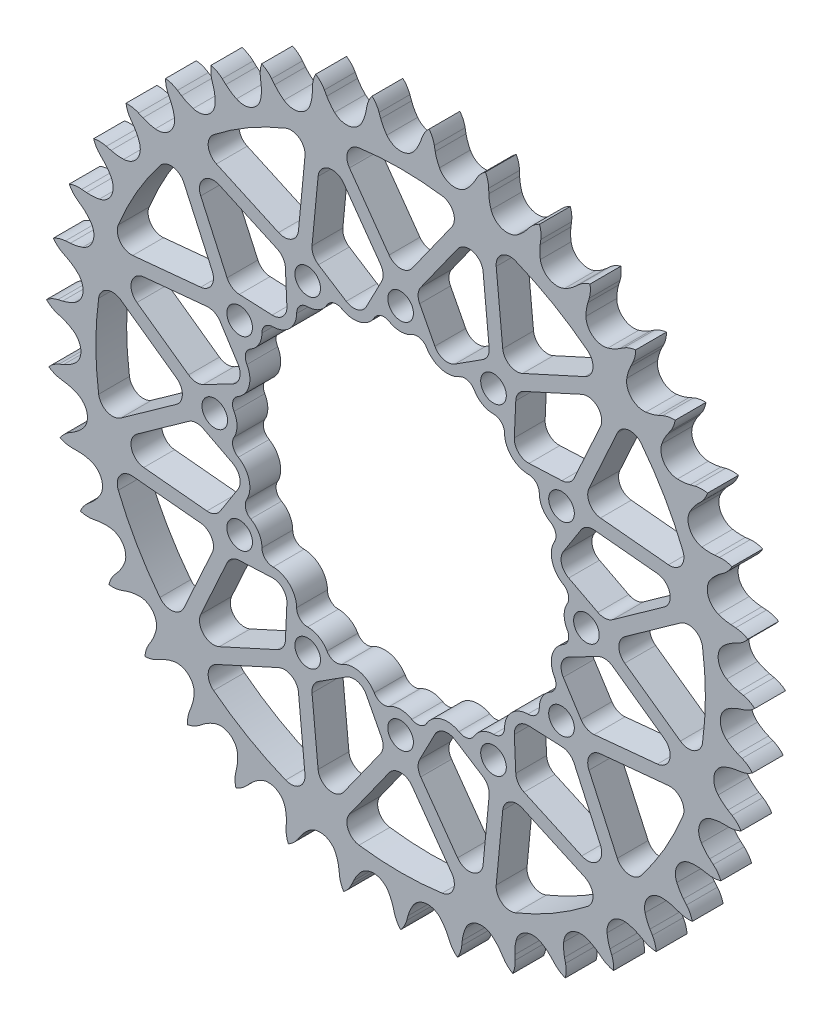
from build123d import *

# Parameters (mm, degrees)
EXTRUSION_DEPTH          = 7.2136
CUT_EXTRUDE_DEPTH        = 118.514389318
CUT_EXTRUDE_DEPTH_BACK   = 118.514389318
SKETCH1_R                = 35.764294032
F_6_0MM_DOWEL_HOLE1_D    = 6
CIRPATTERN1_COUNT        = 12
CUT_EXTRUDE2_DEPTH       = 118.514389318
FILLET2_R                = 3.302
CIRPATTERN3_COUNT        = 12
FILLET2_OF_CIRPATTERN3_R = 3.302
SKETCH14_R               = 35.764294032
CUT_EXTRUDE7_DEPTH       = 118.514389318


with BuildPart() as part:
    # Teeth Sketch → Extrusion (new body)
    with BuildSketch(Plane.XY):
        with BuildLine():
            ThreePointArc((6.676484762, 82.703103732), (5.710873677, 81.555589606), (5.037571935, 80.215493266))
            Line((5.037571935, 80.215493266), (4.65053543, 79.150636707))
            ThreePointArc((4.65053543, 79.150636707), (4.030589042, 77.787636082), (3.22092759, 76.5280518))
            ThreePointArc((3.22092759, 76.5280518), (0, 74.905926143), (-3.22092759, 76.5280518))
            ThreePointArc((-3.22092759, 76.5280518), (-4.030589042, 77.787636082), (-4.65053543, 79.150636707))
            Line((-4.65053543, 79.150636707), (-5.037571935, 80.215493266))
            ThreePointArc((-5.037571935, 80.215493266), (-5.710873677, 81.555589606), (-6.676484762, 82.703103732))
            ThreePointArc((-6.676484762, 82.703103732), (-7.445517227, 81.415554702), (-7.895133318, 79.984807062))
            Line((-7.895133318, 79.984807062), (-8.106342797, 78.871655094))
            ThreePointArc((-8.106342797, 78.871655094), (-8.499620367, 77.426858575), (-9.096745387, 76.053706749))
            ThreePointArc((-9.096745387, 76.053706749), (-12.015755556, 73.935914073), (-15.455180235, 75.020360508))
            ThreePointArc((-15.455180235, 75.020360508), (-16.456408311, 76.133754674), (-17.286967233, 77.379658404))
            Line((-17.286967233, 77.379658404), (-17.83980672, 78.368640329))
            ThreePointArc((-17.83980672, 78.368640329), (-18.719355953, 79.583377579), (-19.856536839, 80.561136787))
            ThreePointArc((-19.856536839, 80.561136787), (-20.409073146, 79.166899696), (-20.623358765, 77.682556369))
            Line((-20.623358765, 77.682556369), (-20.653271004, 76.549939044))
            ThreePointArc((-20.653271004, 76.549939044), (-20.809694072, 75.060766102), (-21.178817437, 73.609610642))
            ThreePointArc((-21.178817437, 73.609610642), (-23.720309356, 71.051000665), (-27.289151829, 71.569681286))
            ThreePointArc((-27.289151829, 71.569681286), (-28.456015249, 72.508049011), (-29.475675664, 73.604587595))
            Line((-29.475675664, 73.604587595), (-30.179999883, 74.492080773))
            ThreePointArc((-30.179999883, 74.492080773), (-31.243016742, 75.549997876), (-32.522315041, 76.332678717))
            ThreePointArc((-32.522315041, 76.332678717), (-32.844044791, 74.867863573), (-32.817450053, 73.368368272))
            Line((-32.817450053, 73.368368272), (-32.66529034, 72.245619783))
            ThreePointArc((-32.66529034, 72.245619783), (-32.580807632, 70.750639215), (-32.71236924, 69.259064285))
            ThreePointArc((-32.71236924, 69.259064285), (-34.810519602, 66.325903661), (-38.416348726, 66.265384911))
            ThreePointArc((-38.416348726, 66.265384911), (-39.71862634, 67.004422965), (-40.900979579, 67.923196629))
            Line((-40.900979579, 67.923196629), (-41.738546902, 68.686215454))
            ThreePointArc((-41.738546902, 68.686215454), (-42.957499809, 69.559912912), (-44.345782367, 70.127244363))
            ThreePointArc((-44.345782367, 70.127244363), (-44.428372928, 68.629789109), (-44.161586623, 67.153977974))
            Line((-44.161586623, 67.153977974), (-43.831295815, 66.070176918))
            ThreePointArc((-43.831295815, 66.070176918), (-43.508095388, 64.608107935), (-43.398687863, 63.114744543))
            ThreePointArc((-43.398687863, 63.114744543), (-44.999155676, 59.883000591), (-48.54858237, 59.244849876))
            ThreePointArc((-48.54858237, 59.244849876), (-49.952545871, 59.765417561), (-51.266969607, 60.48263055))
            Line((-51.266969607, 60.48263055), (-52.21608748, 61.101413234))
            ThreePointArc((-52.21608748, 61.101413234), (-53.559406195, 61.768262742), (-55.020717224, 62.105551216))
            ThreePointArc((-55.020717224, 62.105551216), (-54.862029543, 60.614239157), (-54.361961296, 59.200334922))
            Line((-54.361961296, 59.200334922), (-53.862093752, 58.183551176))
            ThreePointArc((-53.862093752, 58.183551176), (-53.308546327, 56.792260597), (-52.961003266, 55.335786069))
            ThreePointArc((-52.961003266, 55.335786069), (-54.022337255, 51.889159262), (-57.423433231, 50.689904348))
            ThreePointArc((-57.423433231, 50.689904348), (-58.892720703, 50.978519235), (-60.305172051, 51.475596109))
            Line((-60.305172051, 51.475596109), (-61.34125882, 51.934116506))
            ThreePointArc((-61.34125882, 51.934116506), (-62.774152094, 52.376847013), (-64.270644405, 52.475356916))
            ThreePointArc((-64.270644405, 52.475356916), (-63.87478841, 51.02881225), (-63.154389727, 49.713434291))
            Line((-63.154389727, 49.713434291), (-62.497891753, 48.790002021))
            ThreePointArc((-62.497891753, 48.790002021), (-61.728333918, 47.505523541), (-61.151656504, 46.123659804))
            ThreePointArc((-61.151656504, 46.123659804), (-61.646368676, 42.551415963), (-64.811047336, 40.822116924))
            ThreePointArc((-64.811047336, 40.822116924), (-66.307605004, 40.871304038), (-67.781502216, 41.135370767))
            Line((-67.781502216, 41.135370767), (-68.877723777, 41.42175344))
            ThreePointArc((-68.877723777, 41.42175344), (-70.363080428, 41.628898458), (-71.855995657, 41.486078435))
            ThreePointArc((-71.855995657, 41.486078435), (-71.23322381, 40.12176591), (-70.311152637, 38.938981826))
            Line((-70.311152637, 38.938981826), (-69.515027187, 38.132817442))
            ThreePointArc((-69.515027187, 38.132817442), (-68.549390085, 36.988418379), (-67.75851396, 35.716954977))
            ThreePointArc((-67.75851396, 35.716954977), (-67.673791529, 32.111613343), (-70.520089358, 29.897058114))
            ThreePointArc((-70.520089358, 29.897058114), (-72.005157166, 29.705543536), (-73.502327078, 29.729760931))
            Line((-73.502327078, 29.729760931), (-74.630291869, 29.836588719))
            ThreePointArc((-74.630291869, 29.836588719), (-76.129641939, 29.8027833), (-77.580314364, 29.422332315))
            ThreePointArc((-77.580314364, 29.422332315), (-76.74675613, 28.175586908), (-75.646893627, 27.156030185))
            Line((-75.646893627, 27.156030185), (-74.731759931, 26.488012922))
            ThreePointArc((-74.731759931, 26.488012922), (-73.595053056, 25.51333261), (-72.610461496, 24.385199777))
            ThreePointArc((-72.610461496, 24.385199777), (-71.948498729, 20.840136804), (-74.402698108, 18.197681204))
            ThreePointArc((-74.402698108, 18.197681204), (-75.837813579, 17.77042506), (-77.319480277, 17.554165902))
            Line((-77.319480277, 17.554165902), (-78.449974603, 17.478672021))
            ThreePointArc((-78.449974603, 17.478672021), (-79.924485713, 17.204791709), (-81.295343681, 16.596563242))
            ThreePointArc((-81.295343681, 16.596563242), (-80.27258778, 15.499675005), (-79.023419807, 14.669751627))
            Line((-79.023419807, 14.669751627), (-78.012979347, 14.15718278))
            ThreePointArc((-78.012979347, 14.15718278), (-76.734642811, 13.377464928), (-75.58183622, 12.421880712))
            ThreePointArc((-75.58183622, 12.421880712), (-74.359777605, 9.028911669), (-76.358316059, 6.026993909))
            ThreePointArc((-76.358316059, 6.026993909), (-77.706310456, 5.375061909), (-79.134099551, 4.923927198))
            Line((-79.134099551, 4.923927198), (-80.237844202, 4.6680669))
            ThreePointArc((-80.237844202, 4.6680669), (-81.649327289, 4.161205049), (-82.904866299, 3.340951899))
            ThreePointArc((-82.904866299, 3.340951899), (-81.719401571, 2.422329661), (-80.353280924, 1.803534207))
            Line((-80.353280924, 1.803534207), (-79.273703577, 1.45968904))
            ThreePointArc((-79.273703577, 1.45968904), (-77.886845624, 0.895127931), (-76.595681088, 0.136841462))
            ThreePointArc((-76.595681088, 0.136841462), (-74.8451773, -3.016157536), (-76.336293733, -6.299789363))
            ThreePointArc((-76.336293733, -6.299789363), (-77.56225471, -7.159512522), (-78.899187214, -7.833838635))
            Line((-78.899187214, -7.833838635), (-79.947595784, -8.263438702))
            ThreePointArc((-79.947595784, -8.263438702), (-81.259494176, -8.990154635), (-82.367196428, -10.001188343))
            ThreePointArc((-82.367196428, -10.001188343), (-81.049725787, -10.717752749), (-79.602034272, -11.109393802))
            Line((-79.602034272, -11.109393802), (-78.481280524, -11.275609878))
            ThreePointArc((-78.481280524, -11.275609878), (-77.021820047, -11.610392409), (-75.625738049, -12.151741911))
            ThreePointArc((-75.625738049, -12.151741911), (-73.392126218, -14.983109845), (-74.337201497, -18.463411399))
            ThreePointArc((-74.337201497, -18.463411399), (-75.409377308, -19.50865934), (-76.620827372, -20.388712162))
            Line((-76.620827372, -20.388712162), (-77.586746629, -20.980925582))
            ThreePointArc((-77.586746629, -20.980925582), (-78.765082849, -21.908674036), (-79.696259435, -23.08430306))
            ThreePointArc((-79.696259435, -23.08430306), (-78.280904679, -23.580250992), (-76.789136745, -23.734594346))
            Line((-76.789136745, -23.734594346), (-75.656233531, -23.718876424))
            ThreePointArc((-75.656233531, -23.718876424), (-74.161969788, -23.815209685), (-72.697128119, -24.125601551))
            ThreePointArc((-72.697128119, -24.125601551), (-70.038257617, -26.562007479), (-70.41281479, -30.148840778))
            ThreePointArc((-70.41281479, -30.148840778), (-71.303436645, -31.352542128), (-72.358028349, -32.415528753))
            Line((-72.358028349, -32.415528753), (-73.216441492, -33.155017511))
            ThreePointArc((-73.216441492, -33.155017511), (-74.230697248, -34.259770288), (-74.961231185, -35.569546454))
            ThreePointArc((-74.961231185, -35.569546454), (-73.484649258, -35.832033121), (-71.987440912, -35.745081364))
            Line((-71.987440912, -35.745081364), (-70.871729829, -35.547836529))
            ThreePointArc((-70.871729829, -35.547836529), (-69.381363468, -35.403225539), (-67.885700756, -35.474620783))
            ThreePointArc((-67.885700756, -35.474620783), (-64.870434934, -37.452963072), (-64.664773166, -41.053431017))
            ThreePointArc((-64.664773166, -41.053431017), (-65.350774426, -42.384410543), (-66.221194398, -43.602800177))
            Line((-66.221194398, -43.602800177), (-66.949868978, -44.470411902))
            ThreePointArc((-66.949868978, -44.470411902), (-67.773775581, -45.723556485), (-68.284746423, -47.133557278))
            ThreePointArc((-68.284746423, -47.133557278), (-66.785180021, -47.155784414), (-65.321308173, -46.829789551))
            Line((-65.321308173, -46.829789551), (-64.251685552, -46.456126341))
            ThreePointArc((-64.251685552, -46.456126341), (-62.803816278, -46.074316448), (-61.316069403, -45.904865971))
            ThreePointArc((-61.316069403, -45.904865971), (-58.022502061, -47.373906594), (-57.241947884, -50.894758957))
            ThreePointArc((-57.241947884, -50.894758957), (-57.705561477, -52.318544989), (-58.369266298, -53.66078198))
            Line((-58.369266298, -53.66078198), (-58.949330025, -54.634045983))
            ThreePointArc((-58.949330025, -54.634045983), (-59.561548726, -56.003126587), (-59.839722596, -57.476833727))
            ThreePointArc((-59.839722596, -57.476833727), (-58.356009703, -57.25822566), (-56.963387864, -56.701630787))
            Line((-56.963387864, -56.701630787), (-55.967556369, -56.161226883))
            ThreePointArc((-55.967556369, -56.161226883), (-54.599683236, -55.552106762), (-53.15838406, -55.146199243))
            ThreePointArc((-53.15838406, -55.146199243), (-49.671816862, -56.06789082), (-48.336586219, -59.417939375))
            ThreePointArc((-48.336586219, -59.417939375), (-48.565804798, -60.897656602), (-49.00560486, -62.328977716))
            Line((-49.00560486, -62.328977716), (-49.422034389, -63.382686971))
            ThreePointArc((-49.422034389, -63.382686971), (-49.806709045, -64.832245127), (-49.844881387, -66.331490374))
            ThreePointArc((-49.844881387, -66.331490374), (-48.415449386, -65.877708938), (-47.130145731, -65.104929569))
            Line((-47.130145731, -65.104929569), (-46.233896874, -64.411781148))
            ThreePointArc((-46.233896874, -64.411781148), (-44.981447078, -63.591126692), (-43.623924493, -62.959274922))
            ThreePointArc((-43.623924493, -62.959274922), (-40.034657698, -63.309746125), (-38.179332362, -66.402226373))
            ThreePointArc((-38.179332362, -66.402226373), (-38.168219284, -67.899550896), (-38.372723998, -69.38288567))
            Line((-38.372723998, -69.38288567), (-38.614734022, -70.489749661))
            ThreePointArc((-38.614734022, -70.489749661), (-38.761901763, -71.982242573), (-38.559083932, -73.468196262))
            ThreePointArc((-38.559083932, -73.468196262), (-37.220954361, -72.790994159), (-36.076257579, -71.822044874))
            Line((-36.076257579, -71.822044874), (-35.302803736, -70.994104116))
            ThreePointArc((-35.302803736, -70.994104116), (-34.198215068, -69.983169844), (-32.959628196, -69.141738451))
            ThreePointArc((-32.959628196, -69.141738451), (-29.360621929, -68.91191226), (-27.033253851, -71.666730588))
            ThreePointArc((-27.033253851, -71.666730588), (-26.78209694, -73.142882488), (-26.74600974, -74.639813329))
            Line((-26.74600974, -74.639813329), (-26.807332328, -75.77116486))
            ThreePointArc((-26.807332328, -75.77116486), (-26.713181585, -77.267937748), (-26.274626458, -78.702114459))
            ThreePointArc((-26.274626458, -78.702114459), (-25.06245617, -77.819030866), (-24.088013307, -76.679006943))
            Line((-24.088013307, -76.679006943), (-23.457386525, -75.737717079))
            ThreePointArc((-23.457386525, -75.737717079), (-22.529267252, -74.562685657), (-21.441694841, -73.533467273))
            ThreePointArc((-21.441694841, -73.533467273), (-17.926161474, -72.729296065), (-15.187028265, -75.075104125))
            ThreePointArc((-15.187028265, -75.075104125), (-14.702332353, -76.491851845), (-14.426587879, -77.96360903))
            Line((-14.426587879, -77.96360903), (-14.305634807, -79.090146691))
            ThreePointArc((-14.305634807, -79.090146691), (-13.972604036, -80.552433921), (-13.309669959, -81.897689231))
            ThreePointArc((-13.309669959, -81.897689231), (-12.254853529, -80.83159555), (-11.475902142, -79.55002301))
            Line((-11.475902142, -79.55002301), (-11.004435324, -78.519762952))
            ThreePointArc((-11.004435324, -78.519762952), (-10.276823247, -77.211067077), (-9.368432854, -76.020717918))
            ThreePointArc((-9.368432854, -76.020717918), (-6.027422853, -74.663029306), (-2.947466624, -76.5390719))
            ThreePointArc((-2.947466624, -76.5390719), (-2.241785081, -77.859722417), (-1.733524971, -79.26818821))
            Line((-1.733524971, -79.26818821), (-1.43342886, -80.360735266))
            ThreePointArc((-1.43342886, -80.360735266), (-0.870143382, -81.750664368), (0, -82.97215687))
            ThreePointArc((0, -82.97215687), (0.870143382, -81.750664368), (1.43342886, -80.360735266))
            Line((1.43342886, -80.360735266), (1.733524971, -79.26818821))
            ThreePointArc((1.733524971, -79.26818821), (2.241785081, -77.859722417), (2.947466624, -76.5390719))
            ThreePointArc((2.947466624, -76.5390719), (6.027422853, -74.663029306), (9.368432854, -76.020717918))
            ThreePointArc((9.368432854, -76.020717918), (10.276823247, -77.211067077), (11.004435324, -78.519762952))
            Line((11.004435324, -78.519762952), (11.475902142, -79.55002301))
            ThreePointArc((11.475902142, -79.55002301), (12.254853529, -80.83159555), (13.309669959, -81.897689231))
            ThreePointArc((13.309669959, -81.897689231), (13.972604036, -80.552433921), (14.305634807, -79.090146691))
            Line((14.305634807, -79.090146691), (14.426587879, -77.96360903))
            ThreePointArc((14.426587879, -77.96360903), (14.702332353, -76.491851845), (15.187028265, -75.075104125))
            ThreePointArc((15.187028265, -75.075104125), (17.926161474, -72.729296065), (21.441694841, -73.533467273))
            ThreePointArc((21.441694841, -73.533467273), (22.529267252, -74.562685657), (23.457386525, -75.737717079))
            Line((23.457386525, -75.737717079), (24.088013307, -76.679006943))
            ThreePointArc((24.088013307, -76.679006943), (25.06245617, -77.819030866), (26.274626458, -78.702114459))
            ThreePointArc((26.274626458, -78.702114459), (26.713181585, -77.267937748), (26.807332328, -75.77116486))
            Line((26.807332328, -75.77116486), (26.74600974, -74.639813329))
            ThreePointArc((26.74600974, -74.639813329), (26.78209694, -73.142882488), (27.033253851, -71.666730588))
            ThreePointArc((27.033253851, -71.666730588), (29.360621929, -68.91191226), (32.959628196, -69.141738451))
            ThreePointArc((32.959628196, -69.141738451), (34.198215068, -69.983169844), (35.302803736, -70.994104116))
            Line((35.302803736, -70.994104116), (36.076257579, -71.822044874))
            ThreePointArc((36.076257579, -71.822044874), (37.220954361, -72.790994159), (38.559083932, -73.468196262))
            ThreePointArc((38.559083932, -73.468196262), (38.761901763, -71.982242573), (38.614734022, -70.489749661))
            Line((38.614734022, -70.489749661), (38.372723998, -69.38288567))
            ThreePointArc((38.372723998, -69.38288567), (38.168219284, -67.899550896), (38.179332362, -66.402226373))
            ThreePointArc((38.179332362, -66.402226373), (40.034657698, -63.309746125), (43.623924493, -62.959274922))
            ThreePointArc((43.623924493, -62.959274922), (44.981447078, -63.591126692), (46.233896874, -64.411781148))
            Line((46.233896874, -64.411781148), (47.130145731, -65.104929569))
            ThreePointArc((47.130145731, -65.104929569), (48.415449386, -65.877708938), (49.844881387, -66.331490374))
            ThreePointArc((49.844881387, -66.331490374), (49.806709045, -64.832245127), (49.422034389, -63.382686971))
            Line((49.422034389, -63.382686971), (49.00560486, -62.328977716))
            ThreePointArc((49.00560486, -62.328977716), (48.565804798, -60.897656602), (48.336586219, -59.417939375))
            ThreePointArc((48.336586219, -59.417939375), (49.671816862, -56.06789082), (53.15838406, -55.146199243))
            ThreePointArc((53.15838406, -55.146199243), (54.599683236, -55.552106762), (55.967556369, -56.161226883))
            Line((55.967556369, -56.161226883), (56.963387864, -56.701630787))
            ThreePointArc((56.963387864, -56.701630787), (58.356009703, -57.25822566), (59.839722596, -57.476833727))
            ThreePointArc((59.839722596, -57.476833727), (59.561548726, -56.003126587), (58.949330025, -54.634045983))
            Line((58.949330025, -54.634045983), (58.369266298, -53.66078198))
            ThreePointArc((58.369266298, -53.66078198), (57.705561477, -52.318544989), (57.241947884, -50.894758957))
            ThreePointArc((57.241947884, -50.894758957), (58.022502061, -47.373906594), (61.316069403, -45.904865971))
            ThreePointArc((61.316069403, -45.904865971), (62.803816278, -46.074316448), (64.251685552, -46.456126341))
            Line((64.251685552, -46.456126341), (65.321308173, -46.829789551))
            ThreePointArc((65.321308173, -46.829789551), (66.785180021, -47.155784414), (68.284746423, -47.133557278))
            ThreePointArc((68.284746423, -47.133557278), (67.773775581, -45.723556485), (66.949868978, -44.470411902))
            Line((66.949868978, -44.470411902), (66.221194398, -43.602800177))
            ThreePointArc((66.221194398, -43.602800177), (65.350774426, -42.384410543), (64.664773166, -41.053431017))
            ThreePointArc((64.664773166, -41.053431017), (64.870434934, -37.452963072), (67.885700756, -35.474620783))
            ThreePointArc((67.885700756, -35.474620783), (69.381363468, -35.403225539), (70.871729829, -35.547836529))
            Line((70.871729829, -35.547836529), (71.987440912, -35.745081364))
            ThreePointArc((71.987440912, -35.745081364), (73.484649258, -35.832033121), (74.961231185, -35.569546454))
            ThreePointArc((74.961231185, -35.569546454), (74.230697248, -34.259770288), (73.216441492, -33.155017511))
            Line((73.216441492, -33.155017511), (72.358028349, -32.415528753))
            ThreePointArc((72.358028349, -32.415528753), (71.303436645, -31.352542128), (70.41281479, -30.148840778))
            ThreePointArc((70.41281479, -30.148840778), (70.038257617, -26.562007479), (72.697128119, -24.125601551))
            ThreePointArc((72.697128119, -24.125601551), (74.161969788, -23.815209685), (75.656233531, -23.718876424))
            Line((75.656233531, -23.718876424), (76.789136745, -23.734594346))
            ThreePointArc((76.789136745, -23.734594346), (78.280904679, -23.580250992), (79.696259435, -23.08430306))
            ThreePointArc((79.696259435, -23.08430306), (78.765082849, -21.908674036), (77.586746629, -20.980925582))
            Line((77.586746629, -20.980925582), (76.620827372, -20.388712162))
            ThreePointArc((76.620827372, -20.388712162), (75.409377308, -19.50865934), (74.337201497, -18.463411399))
            ThreePointArc((74.337201497, -18.463411399), (73.392126218, -14.983109845), (75.625738049, -12.151741911))
            ThreePointArc((75.625738049, -12.151741911), (77.021820047, -11.610392409), (78.481280524, -11.275609878))
            Line((78.481280524, -11.275609878), (79.602034272, -11.109393802))
            ThreePointArc((79.602034272, -11.109393802), (81.049725787, -10.717752749), (82.367196428, -10.001188343))
            ThreePointArc((82.367196428, -10.001188343), (81.259494176, -8.990154635), (79.947595784, -8.263438702))
            Line((79.947595784, -8.263438702), (78.899187214, -7.833838635))
            ThreePointArc((78.899187214, -7.833838635), (77.56225471, -7.159512522), (76.336293733, -6.299789363))
            ThreePointArc((76.336293733, -6.299789363), (74.8451773, -3.016157536), (76.595681088, 0.136841462))
            ThreePointArc((76.595681088, 0.136841462), (77.886845624, 0.895127931), (79.273703577, 1.45968904))
            Line((79.273703577, 1.45968904), (80.353280924, 1.803534207))
            ThreePointArc((80.353280924, 1.803534207), (81.719401571, 2.422329661), (82.904866299, 3.340951899))
            ThreePointArc((82.904866299, 3.340951899), (81.649327289, 4.161205049), (80.237844202, 4.6680669))
            Line((80.237844202, 4.6680669), (79.134099551, 4.923927198))
            ThreePointArc((79.134099551, 4.923927198), (77.706310456, 5.375061909), (76.358316059, 6.026993909))
            ThreePointArc((76.358316059, 6.026993909), (74.359777605, 9.028911669), (75.58183622, 12.421880712))
            ThreePointArc((75.58183622, 12.421880712), (76.734642811, 13.377464928), (78.012979347, 14.15718278))
            Line((78.012979347, 14.15718278), (79.023419807, 14.669751627))
            ThreePointArc((79.023419807, 14.669751627), (80.27258778, 15.499675005), (81.295343681, 16.596563242))
            ThreePointArc((81.295343681, 16.596563242), (79.924485713, 17.204791709), (78.449974603, 17.478672021))
            Line((78.449974603, 17.478672021), (77.319480277, 17.554165902))
            ThreePointArc((77.319480277, 17.554165902), (75.837813579, 17.77042506), (74.402698108, 18.197681204))
            ThreePointArc((74.402698108, 18.197681204), (71.948498729, 20.840136804), (72.610461496, 24.385199777))
            ThreePointArc((72.610461496, 24.385199777), (73.595053056, 25.51333261), (74.731759931, 26.488012922))
            Line((74.731759931, 26.488012922), (75.646893627, 27.156030185))
            ThreePointArc((75.646893627, 27.156030185), (76.74675613, 28.175586908), (77.580314364, 29.422332315))
            ThreePointArc((77.580314364, 29.422332315), (76.129641939, 29.8027833), (74.630291869, 29.836588719))
            Line((74.630291869, 29.836588719), (73.502327078, 29.729760931))
            ThreePointArc((73.502327078, 29.729760931), (72.005157166, 29.705543536), (70.520089358, 29.897058114))
            ThreePointArc((70.520089358, 29.897058114), (67.673791529, 32.111613343), (67.75851396, 35.716954977))
            ThreePointArc((67.75851396, 35.716954977), (68.549390085, 36.988418379), (69.515027187, 38.132817442))
            Line((69.515027187, 38.132817442), (70.311152637, 38.938981826))
            ThreePointArc((70.311152637, 38.938981826), (71.23322381, 40.12176591), (71.855995657, 41.486078435))
            ThreePointArc((71.855995657, 41.486078435), (70.363080428, 41.628898458), (68.877723777, 41.42175344))
            Line((68.877723777, 41.42175344), (67.781502216, 41.135370767))
            ThreePointArc((67.781502216, 41.135370767), (66.307605004, 40.871304038), (64.811047336, 40.822116924))
            ThreePointArc((64.811047336, 40.822116924), (61.646368676, 42.551415963), (61.151656504, 46.123659804))
            ThreePointArc((61.151656504, 46.123659804), (61.728333918, 47.505523541), (62.497891753, 48.790002021))
            Line((62.497891753, 48.790002021), (63.154389727, 49.713434291))
            ThreePointArc((63.154389727, 49.713434291), (63.87478841, 51.02881225), (64.270644405, 52.475356916))
            ThreePointArc((64.270644405, 52.475356916), (62.774152094, 52.376847013), (61.34125882, 51.934116506))
            Line((61.34125882, 51.934116506), (60.305172051, 51.475596109))
            ThreePointArc((60.305172051, 51.475596109), (58.892720703, 50.978519235), (57.423433231, 50.689904348))
            ThreePointArc((57.423433231, 50.689904348), (54.022337255, 51.889159262), (52.961003266, 55.335786069))
            ThreePointArc((52.961003266, 55.335786069), (53.308546327, 56.792260597), (53.862093752, 58.183551176))
            Line((53.862093752, 58.183551176), (54.361961296, 59.200334922))
            ThreePointArc((54.361961296, 59.200334922), (54.862029543, 60.614239157), (55.020717224, 62.105551216))
            ThreePointArc((55.020717224, 62.105551216), (53.559406195, 61.768262742), (52.21608748, 61.101413234))
            Line((52.21608748, 61.101413234), (51.266969607, 60.48263055))
            ThreePointArc((51.266969607, 60.48263055), (49.952545871, 59.765417561), (48.54858237, 59.244849876))
            ThreePointArc((48.54858237, 59.244849876), (44.999155676, 59.883000591), (43.398687863, 63.114744543))
            ThreePointArc((43.398687863, 63.114744543), (43.508095388, 64.608107935), (43.831295815, 66.070176918))
            Line((43.831295815, 66.070176918), (44.161586623, 67.153977974))
            ThreePointArc((44.161586623, 67.153977974), (44.428372928, 68.629789109), (44.345782367, 70.127244363))
            ThreePointArc((44.345782367, 70.127244363), (42.957499809, 69.559912912), (41.738546902, 68.686215454))
            Line((41.738546902, 68.686215454), (40.900979579, 67.923196629))
            ThreePointArc((40.900979579, 67.923196629), (39.71862634, 67.004422965), (38.416348726, 66.265384911))
            ThreePointArc((38.416348726, 66.265384911), (34.810519602, 66.325903661), (32.71236924, 69.259064285))
            ThreePointArc((32.71236924, 69.259064285), (32.580807632, 70.750639215), (32.66529034, 72.245619783))
            Line((32.66529034, 72.245619783), (32.817450053, 73.368368272))
            ThreePointArc((32.817450053, 73.368368272), (32.844044791, 74.867863573), (32.522315041, 76.332678717))
            ThreePointArc((32.522315041, 76.332678717), (31.243016742, 75.549997876), (30.179999883, 74.492080773))
            Line((30.179999883, 74.492080773), (29.475675664, 73.604587595))
            ThreePointArc((29.475675664, 73.604587595), (28.456015249, 72.508049011), (27.289151829, 71.569681286))
            ThreePointArc((27.289151829, 71.569681286), (23.720309356, 71.051000665), (21.178817437, 73.609610642))
            ThreePointArc((21.178817437, 73.609610642), (20.809694072, 75.060766102), (20.653271004, 76.549939044))
            Line((20.653271004, 76.549939044), (20.623358765, 77.682556369))
            ThreePointArc((20.623358765, 77.682556369), (20.409073146, 79.166899696), (19.856536839, 80.561136787))
            ThreePointArc((19.856536839, 80.561136787), (18.719355953, 79.583377579), (17.83980672, 78.368640329))
            Line((17.83980672, 78.368640329), (17.286967233, 77.379658404))
            ThreePointArc((17.286967233, 77.379658404), (16.456408311, 76.133754674), (15.455180235, 75.020360508))
            ThreePointArc((15.455180235, 75.020360508), (12.015755556, 73.935914073), (9.096745387, 76.053706749))
            ThreePointArc((9.096745387, 76.053706749), (8.499620367, 77.426858575), (8.106342797, 78.871655094))
            Line((8.106342797, 78.871655094), (7.895133318, 79.984807062))
            ThreePointArc((7.895133318, 79.984807062), (7.445517227, 81.415554702), (6.676484762, 82.703103732))
        make_face()
    extrude(amount=EXTRUSION_DEPTH)

    # Sketch1 → Cut-Extrude (cut, two sides: drawn at the far end of the back side and taken through both)
    with BuildSketch(Plane(origin=(0, 0, 0), x_dir=(-1, 0, 0), z_dir=(0, 0, -1)).offset(-CUT_EXTRUDE_DEPTH_BACK)):
        Circle(SKETCH1_R)
    extrude(amount=CUT_EXTRUDE_DEPTH + CUT_EXTRUDE_DEPTH_BACK, mode=Mode.SUBTRACT)

    # Ø6.0mm Dowel Hole1 (through all)
    with Locations(Plane.XY.offset(7.2136)):
        with Locations((-43.500000122, 0)):
            f_6_0mm_dowel_hole1 = Hole(F_6_0MM_DOWEL_HOLE1_D / 2)

    # CirPattern1: Ø6.0mm Dowel Hole1 ×12 about axis
    cirpattern1_axis = Axis((0, 0, 7.2136), (0, 0, -1))
    for i in range(1, CIRPATTERN1_COUNT):
        add(f_6_0mm_dowel_hole1.rotate(cirpattern1_axis, i * 360 / CIRPATTERN1_COUNT), mode=Mode.SUBTRACT)

    # Sketch9 → Cut-Extrude2 (cut, through all)
    with BuildSketch(Plane.XY):
        with BuildLine():
            Line((-48.707000122, 0), (-69.753908506, 15.006805414))
            ThreePointArc((-69.753908506, 15.006805414), (-71.349926143, 0), (-69.753908506, -15.006805414))
            Line((-69.753908506, -15.006805414), (-48.707000122, 0))
        make_face()
        Polygon((-43.325238517, 20.926367996), (-68.918736366, 18.466719753), (-47.983941179, 3.539852965), (-36.140398804, 9.683790674), align=None)
    cut_extrude2 = extrude(amount=CUT_EXTRUDE2_DEPTH, mode=Mode.SUBTRACT)

    # Fillet2
    fillet2_edges = [part.edges().sort_by_distance(p)[0] for p in [
        (-68.918736366, 18.466719753, 3.6068),
        (-36.140398804, 9.683790674, 3.6068),
        (-47.983941179, 3.539852965, 3.6068),
        (-43.325238517, 20.926367996, 3.6068),
        (-69.753908506, -15.006805414, 3.6068),
        (-48.707000122, 0, 3.6068),
        (-69.753908506, 15.006805414, 3.6068),
    ]]
    fillet(fillet2_edges, radius=FILLET2_R)

    # CirPattern3: Cut-Extrude2 ×12 about axis
    cirpattern3_axis = Axis((0, 0, 7.2136), (0, 0, -1))
    for i in range(1, CIRPATTERN3_COUNT):
        add(cut_extrude2.rotate(cirpattern3_axis, i * 360 / CIRPATTERN3_COUNT), mode=Mode.SUBTRACT)

    # Fillet2 of CirPattern3
    fillet2_of_cirpattern3_edges = [part.edges().sort_by_distance(p)[0] for p in [
        (-50.452016613, 50.452016613, 3.6068),
        (-26.45660813, 26.45660813, 3.6068),
        (-39.785385552, 27.057573183, 3.6068),
        (-27.057573183, 39.785385552, 3.6068),
        (-67.912059487, 21.880679535, 3.6068),
        (-42.181499448, 24.353500061, 3.6068),
        (-52.905254073, 47.873228971, 3.6068),
        (-18.466719753, 68.918736366, 3.6068),
        (-9.683790674, 36.140398804, 3.6068),
        (-20.926367996, 43.325238517, 3.6068),
        (-3.539852965, 47.983941179, 3.6068),
        (-47.873228971, 52.905254073, 3.6068),
        (-24.353500061, 42.181499448, 3.6068),
        (-21.880679535, 67.912059487, 3.6068),
        (18.466719753, 68.918736366, 3.6068),
        (9.683790674, 36.140398804, 3.6068),
        (3.539852965, 47.983941179, 3.6068),
        (20.926367996, 43.325238517, 3.6068),
        (-15.006805414, 69.753908506, 3.6068),
        (0, 48.707000122, 3.6068),
        (15.006805414, 69.753908506, 3.6068),
        (50.452016613, 50.452016613, 3.6068),
        (26.45660813, 26.45660813, 3.6068),
        (27.057573183, 39.785385552, 3.6068),
        (39.785385552, 27.057573183, 3.6068),
        (21.880679535, 67.912059487, 3.6068),
        (24.353500061, 42.181499448, 3.6068),
        (47.873228971, 52.905254073, 3.6068),
        (68.918736366, 18.466719753, 3.6068),
        (36.140398804, 9.683790674, 3.6068),
        (43.325238517, 20.926367996, 3.6068),
        (47.983941179, 3.539852965, 3.6068),
        (52.905254073, 47.873228971, 3.6068),
        (42.181499448, 24.353500061, 3.6068),
        (67.912059487, 21.880679535, 3.6068),
        (68.918736366, -18.466719753, 3.6068),
        (36.140398804, -9.683790674, 3.6068),
        (47.983941179, -3.539852965, 3.6068),
        (43.325238517, -20.926367996, 3.6068),
        (69.753908506, 15.006805414, 3.6068),
        (48.707000122, 0, 3.6068),
        (69.753908506, -15.006805414, 3.6068),
        (50.452016613, -50.452016613, 3.6068),
        (26.45660813, -26.45660813, 3.6068),
        (39.785385552, -27.057573183, 3.6068),
        (27.057573183, -39.785385552, 3.6068),
        (67.912059487, -21.880679535, 3.6068),
        (42.181499448, -24.353500061, 3.6068),
        (52.905254073, -47.873228971, 3.6068),
        (18.466719753, -68.918736366, 3.6068),
        (9.683790674, -36.140398804, 3.6068),
        (20.926367996, -43.325238517, 3.6068),
        (3.539852965, -47.983941179, 3.6068),
        (47.873228971, -52.905254073, 3.6068),
        (24.353500061, -42.181499448, 3.6068),
        (21.880679535, -67.912059487, 3.6068),
        (-18.466719753, -68.918736366, 3.6068),
        (-9.683790674, -36.140398804, 3.6068),
        (-3.539852965, -47.983941179, 3.6068),
        (-20.926367996, -43.325238517, 3.6068),
        (15.006805414, -69.753908506, 3.6068),
        (0, -48.707000122, 3.6068),
        (-15.006805414, -69.753908506, 3.6068),
        (-50.452016613, -50.452016613, 3.6068),
        (-26.45660813, -26.45660813, 3.6068),
        (-27.057573183, -39.785385552, 3.6068),
        (-39.785385552, -27.057573183, 3.6068),
        (-21.880679535, -67.912059487, 3.6068),
        (-24.353500061, -42.181499448, 3.6068),
        (-47.873228971, -52.905254073, 3.6068),
        (-68.918736366, -18.466719753, 3.6068),
        (-36.140398804, -9.683790674, 3.6068),
        (-43.325238517, -20.926367996, 3.6068),
        (-47.983941179, -3.539852965, 3.6068),
        (-52.905254073, -47.873228971, 3.6068),
        (-42.181499448, -24.353500061, 3.6068),
        (-67.912059487, -21.880679535, 3.6068),
    ]]
    fillet(fillet2_of_cirpattern3_edges, radius=FILLET2_OF_CIRPATTERN3_R)

    # Sketch14 → Cut-Extrude7 (cut, through all)
    with BuildSketch(Plane.XY.offset(7.2136)):
        with BuildLine():
            Line((-38.295599647, 5.990473358), (-37.976638316, 6.155937244))
            ThreePointArc((-37.976638316, 6.155937244), (-39.24649701, 4.608711867), (-39.001430567, 2.622159599))
            ThreePointArc((-39.001430567, 2.622159599), (-38.293000122, 0), (-39.001430567, -2.622159599))
            ThreePointArc((-39.001430567, -2.622159599), (-39.24649701, -4.608711867), (-37.976638316, -6.155937244))
            Line((-37.976638316, -6.155937244), (-38.295599647, -5.990473358))
            ThreePointArc((-38.295599647, -5.990473358), (-35.471196357, -9.504478418), (-36.160198827, -13.959897715))
            Line((-36.160198827, -13.959897715), (-35.966702154, -13.65712112))
            ThreePointArc((-35.966702154, -13.65712112), (-36.292819354, -15.63198695), (-35.087309455, -17.229858458))
            ThreePointArc((-35.087309455, -17.229858458), (-33.162710893, -19.146500061), (-32.465149856, -21.771572109))
            ThreePointArc((-32.465149856, -21.771572109), (-31.684107487, -23.61451006), (-29.81076491, -24.319517196))
            Line((-29.81076491, -24.319517196), (-30.169725469, -24.335701932))
            ThreePointArc((-30.169725469, -24.335701932), (-25.966717938, -25.966717938), (-24.335701932, -30.169725469))
            Line((-24.335701932, -30.169725469), (-24.319517196, -29.81076491))
            ThreePointArc((-24.319517196, -29.81076491), (-23.61451006, -31.684107487), (-21.771572109, -32.465149856))
            ThreePointArc((-21.771572109, -32.465149856), (-19.146500061, -33.162710893), (-17.229858458, -35.087309455))
            ThreePointArc((-17.229858458, -35.087309455), (-15.63198695, -36.292819354), (-13.65712112, -35.966702154))
            Line((-13.65712112, -35.966702154), (-13.959897715, -36.160198827))
            ThreePointArc((-13.959897715, -36.160198827), (-9.504478418, -35.471196357), (-5.990473358, -38.295599647))
            Line((-5.990473358, -38.295599647), (-6.155937244, -37.976638316))
            ThreePointArc((-6.155937244, -37.976638316), (-4.608711867, -39.24649701), (-2.622159599, -39.001430567))
            ThreePointArc((-2.622159599, -39.001430567), (0, -38.293000122), (2.622159599, -39.001430567))
            ThreePointArc((2.622159599, -39.001430567), (4.608711867, -39.24649701), (6.155937244, -37.976638316))
            Line((6.155937244, -37.976638316), (5.990473358, -38.295599647))
            ThreePointArc((5.990473358, -38.295599647), (9.504478418, -35.471196357), (13.959897715, -36.160198827))
            Line((13.959897715, -36.160198827), (13.65712112, -35.966702154))
            ThreePointArc((13.65712112, -35.966702154), (15.63198695, -36.292819354), (17.229858458, -35.087309455))
            ThreePointArc((17.229858458, -35.087309455), (19.146500061, -33.162710893), (21.771572109, -32.465149856))
            ThreePointArc((21.771572109, -32.465149856), (23.61451006, -31.684107487), (24.319517196, -29.81076491))
            Line((24.319517196, -29.81076491), (24.335701932, -30.169725469))
            ThreePointArc((24.335701932, -30.169725469), (25.966717938, -25.966717938), (30.169725469, -24.335701932))
            Line((30.169725469, -24.335701932), (29.81076491, -24.319517196))
            ThreePointArc((29.81076491, -24.319517196), (31.684107487, -23.61451006), (32.465149856, -21.771572109))
            ThreePointArc((32.465149856, -21.771572109), (33.162710893, -19.146500061), (35.087309455, -17.229858458))
            ThreePointArc((35.087309455, -17.229858458), (36.292819354, -15.63198695), (35.966702154, -13.65712112))
            Line((35.966702154, -13.65712112), (36.160198827, -13.959897715))
            ThreePointArc((36.160198827, -13.959897715), (35.471196357, -9.504478418), (38.295599647, -5.990473358))
            Line((38.295599647, -5.990473358), (37.976638316, -6.155937244))
            ThreePointArc((37.976638316, -6.155937244), (39.24649701, -4.608711867), (39.001430567, -2.622159599))
            ThreePointArc((39.001430567, -2.622159599), (38.293000122, 0), (39.001430567, 2.622159599))
            ThreePointArc((39.001430567, 2.622159599), (39.24649701, 4.608711867), (37.976638316, 6.155937244))
            Line((37.976638316, 6.155937244), (38.295599647, 5.990473358))
            ThreePointArc((38.295599647, 5.990473358), (35.471196357, 9.504478418), (36.160198827, 13.959897715))
            Line((36.160198827, 13.959897715), (35.966702154, 13.65712112))
            ThreePointArc((35.966702154, 13.65712112), (36.292819354, 15.63198695), (35.087309455, 17.229858458))
            ThreePointArc((35.087309455, 17.229858458), (33.162710893, 19.146500061), (32.465149856, 21.771572109))
            ThreePointArc((32.465149856, 21.771572109), (31.684107487, 23.61451006), (29.81076491, 24.319517196))
            Line((29.81076491, 24.319517196), (30.169725469, 24.335701932))
            ThreePointArc((30.169725469, 24.335701932), (25.966717938, 25.966717938), (24.335701932, 30.169725469))
            Line((24.335701932, 30.169725469), (24.319517196, 29.81076491))
            ThreePointArc((24.319517196, 29.81076491), (23.61451006, 31.684107487), (21.771572109, 32.465149856))
            ThreePointArc((21.771572109, 32.465149856), (19.146500061, 33.162710893), (17.229858458, 35.087309455))
            ThreePointArc((17.229858458, 35.087309455), (15.63198695, 36.292819354), (13.65712112, 35.966702154))
            Line((13.65712112, 35.966702154), (13.959897715, 36.160198827))
            ThreePointArc((13.959897715, 36.160198827), (9.504478418, 35.471196357), (5.990473358, 38.295599647))
            Line((5.990473358, 38.295599647), (6.155937244, 37.976638316))
            ThreePointArc((6.155937244, 37.976638316), (4.608711867, 39.24649701), (2.622159599, 39.001430567))
            ThreePointArc((2.622159599, 39.001430567), (0, 38.293000122), (-2.622159599, 39.001430567))
            ThreePointArc((-2.622159599, 39.001430567), (-4.608711867, 39.24649701), (-6.155937244, 37.976638316))
            Line((-6.155937244, 37.976638316), (-5.990473358, 38.295599647))
            ThreePointArc((-5.990473358, 38.295599647), (-9.504478418, 35.471196357), (-13.959897715, 36.160198827))
            Line((-13.959897715, 36.160198827), (-13.65712112, 35.966702154))
            ThreePointArc((-13.65712112, 35.966702154), (-15.63198695, 36.292819354), (-17.229858458, 35.087309455))
            ThreePointArc((-17.229858458, 35.087309455), (-19.146500061, 33.162710893), (-21.771572109, 32.465149856))
            ThreePointArc((-21.771572109, 32.465149856), (-23.61451006, 31.684107487), (-24.319517196, 29.81076491))
            Line((-24.319517196, 29.81076491), (-24.335701932, 30.169725469))
            ThreePointArc((-24.335701932, 30.169725469), (-25.966717938, 25.966717938), (-30.169725469, 24.335701932))
            Line((-30.169725469, 24.335701932), (-29.81076491, 24.319517196))
            ThreePointArc((-29.81076491, 24.319517196), (-31.684107487, 23.61451006), (-32.465149856, 21.771572109))
            ThreePointArc((-32.465149856, 21.771572109), (-33.162710893, 19.146500061), (-35.087309455, 17.229858458))
            ThreePointArc((-35.087309455, 17.229858458), (-36.292819354, 15.63198695), (-35.966702154, 13.65712112))
            Line((-35.966702154, 13.65712112), (-36.160198827, 13.959897715))
            ThreePointArc((-36.160198827, 13.959897715), (-35.471196357, 9.504478418), (-38.295599647, 5.990473358))
        make_face()
        Circle(SKETCH14_R, mode=Mode.SUBTRACT)
    extrude(amount=-CUT_EXTRUDE7_DEPTH, mode=Mode.SUBTRACT)


solid = part.part
